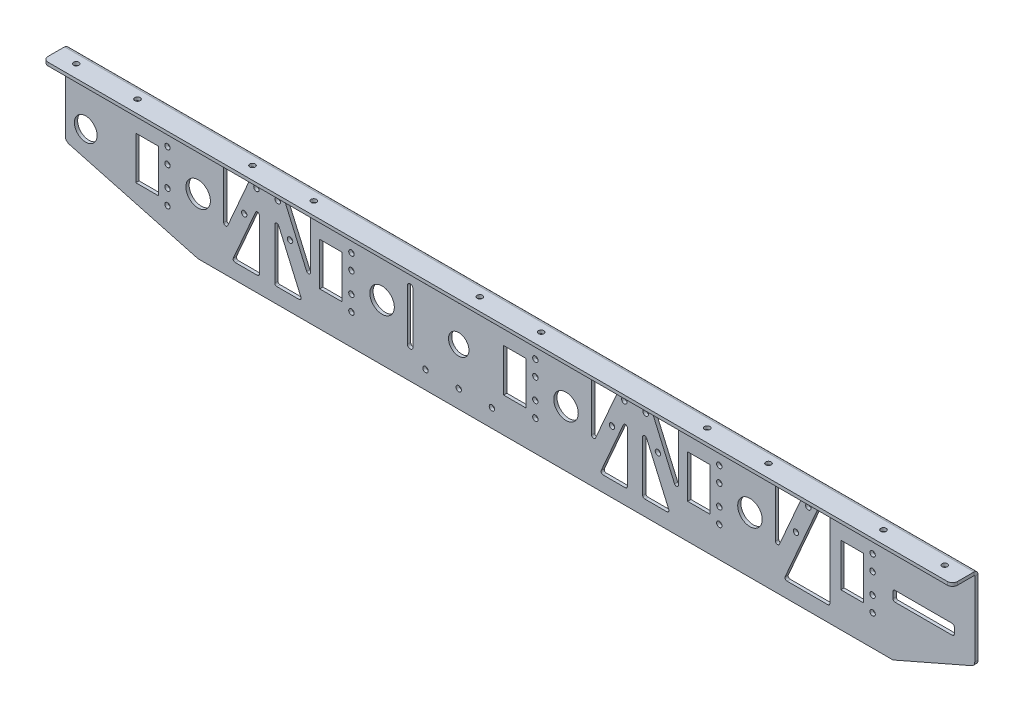
from build123d import *

# Parameters (mm, degrees)
SKETCH1_R                                  = 11.9875
SKETCH1_R_2                                = 11.1125
SKETCH1_W                                  = 60
SKETCH1_H                                  = 10.02
BASE_FLANGE1_DEPTH                         = 3.175
M5_CLEARANCE_HOLE1_D                       = 5.3
INNER_START                                = -3.175
SKETCH9_W                                  = 22
SKETCH9_H                                  = 42
SKETCH9_R                                  = 2.65
INNER_PLATE_CUT_EXTRUDE3_DEPTH             = 3.175
SKETCH8_R                                  = 2.65
SWISS_CHEESE_CUTOUT_DEPTH                  = 3.175
FILLET1_R                                  = 2
OUTWARD_EDGE_FLANGE_STRIP_W                = 14.1732
OUTWARD_EDGE_FLANGE_STRIP_H                = 3.175
OUTWARD_EDGE_FLANGE_STRIP_CUT_DEPTH        = 890
OUTWARD_EDGE_FLANGE_DEPTH                  = 890
OUTWARD_M5_CLEARANCE_HOLE4_D               = 5.3
FILLET3_R                                  = 5
SKETCH13_W                                 = 85
SKETCH13_H                                 = 80
INNER_PLATE_SWISS_CHEESE_FILL_DEPTH        = 3.175
INNER_PLATE_MOTOR_MOUNT_REACH              = 764.677
SKETCH14_R                                 = 10
INNER_PLATE_MOTOR_M5_CLEARANCE_HOLES_D     = 5.3
INNER_PLATE_MOTOR_M5_CLEARANCE_HOLES_DEPTH = 5
INNER_PLATE_MOTOR_M5_CLEARANCE_HOLES_TIP   = 1.59228064


# Sheet-metal steps are written as plain solids
with BuildPart() as part:
    # Sketch1 → Base-Flange1 (new body)
    with BuildSketch(Plane.XY):
        Polygon((-130, 60), (760, 60), (760, -20), (680, -55), (0, -55), (-130, -20), align=None)
        Circle(SKETCH1_R, mode=Mode.SUBTRACT)
        with Locations((180, 0)):
            Circle(SKETCH1_R, mode=Mode.SUBTRACT)
        with Locations((360, 0)):
            Circle(SKETCH1_R, mode=Mode.SUBTRACT)
        with Locations((540, 0)):
            Circle(SKETCH1_R, mode=Mode.SUBTRACT)
        with Locations((-110, 0)):
            Circle(SKETCH1_R_2, mode=Mode.SUBTRACT)
        with Locations((710, 0)):
            Rectangle(SKETCH1_W, SKETCH1_H, mode=Mode.SUBTRACT)
    extrude(amount=-BASE_FLANGE1_DEPTH)

    # M5 Clearance Hole1 (through all)
    with Locations(Plane(origin=(-50, 10, 0), x_dir=(1, 0, 0), z_dir=(0, 0, 1))):
        with Locations((0, 0), (0, -20), (20, -35), (20, 15), (180, 0), (180, -20), (200, -35), (200, 15), (360, 0), (360, -20), (380, -35), (380, 15), (540, 0), (540, -20), (560, -35), (560, 15), (690, 0), (690, -20), (710, 15), (710, -35), (20, 0), (20, -20), (200, 0), (200, -20), (380, 0), (380, -20), (560, 0), (560, -20), (710, 0), (710, -20)):
            Hole(M5_CLEARANCE_HOLE1_D / 2)

    # Sketch9 → Inner Plate Cut-Extrude3 (cut)
    # profile 1 of 7: a face of its own
    with BuildSketch(Plane.XY.offset(INNER_START)):
        with Locations((-50, 0)):
            Rectangle(SKETCH9_W, SKETCH9_H)
        with BuildLine():
            ThreePointArc((-47.35, -10), (-51.87383297, -11.87383297), (-50, -7.35))
            ThreePointArc((-50, -7.35), (-48.12616703, -8.12616703), (-47.35, -10))
        make_face(mode=Mode.SUBTRACT)
        with BuildLine():
            ThreePointArc((-47.35, 10), (-48.12616703, 8.12616703), (-50, 7.35))
            ThreePointArc((-50, 7.35), (-51.87383297, 11.87383297), (-47.35, 10))
        make_face(mode=Mode.SUBTRACT)
    # profile 2 of 7: a face of its own
    with BuildSketch(Plane.XY.offset(INNER_START)):
        with Locations((130, 0)):
            Rectangle(SKETCH9_W, SKETCH9_H)
        with Locations((130, -10)):
            Circle(SKETCH9_R, mode=Mode.SUBTRACT)
        with Locations((130, 10)):
            Circle(SKETCH9_R, mode=Mode.SUBTRACT)
    # profile 3 of 7: a face of its own
    with BuildSketch(Plane.XY.offset(INNER_START)):
        with Locations((310, 0)):
            Rectangle(SKETCH9_W, SKETCH9_H)
        with Locations((310, -10)):
            Circle(SKETCH9_R, mode=Mode.SUBTRACT)
        with Locations((310, 10)):
            Circle(SKETCH9_R, mode=Mode.SUBTRACT)
    # profile 4 of 7: a face of its own
    with BuildSketch(Plane.XY.offset(INNER_START)):
        with Locations((490, 0)):
            Rectangle(SKETCH9_W, SKETCH9_H)
        with Locations((490, -10)):
            Circle(SKETCH9_R, mode=Mode.SUBTRACT)
        with Locations((490, 10)):
            Circle(SKETCH9_R, mode=Mode.SUBTRACT)
    # profile 5 of 7: a face of its own
    with BuildSketch(Plane.XY.offset(INNER_START)):
        with Locations((640, 0)):
            Rectangle(SKETCH9_W, SKETCH9_H)
        with Locations((640, -10)):
            Circle(SKETCH9_R, mode=Mode.SUBTRACT)
        with Locations((640, 10)):
            Circle(SKETCH9_R, mode=Mode.SUBTRACT)
    # profile 6 of 7: a face of its own
    with BuildSketch(Plane.XY.offset(INNER_START)):
        with Locations((-30, -10)):
            Circle(SKETCH9_R)
    # profile 7 of 7: a face of its own
    with BuildSketch(Plane.XY.offset(INNER_START)):
        with Locations((-30, 10)):
            Circle(SKETCH9_R)
    extrude(amount=INNER_PLATE_CUT_EXTRUDE3_DEPTH, mode=Mode.SUBTRACT)

    # Sketch8 → Swiss Cheese Cutout (cut)
    with BuildSketch(Plane.XY):
        Polygon((51.813633189, 40), (25, 40), (25, -21.288304432), align=None)
        Polygon((60, -40), (33.186366811, -40), (60, 21.288304432), align=None)
        Polygon((75, -40), (75, 21.288304432), (101.813633189, -40), align=None)
        Polygon((110, 40), (110, -21.288304432), (83.186366811, 40), align=None)
        Polygon((231.813633189, 40), (205, -21.288304432), (205, 40), align=None)
        Polygon((240, 21.288304432), (240, -40), (213.186366811, -40), align=None)
        Polygon((281.813633189, -40), (255, -40), (255, 21.288304432), align=None)
        Polygon((263.186366811, 40), (290, 40), (290, -21.288304432), align=None)
        Polygon((411.813633189, 40), (385, -21.288304432), (385, 40), align=None)
        Polygon((420, 21.288304432), (420, -40), (393.186366811, -40), align=None)
        Polygon((461.813633189, -40), (435, -40), (435, 21.288304432), align=None)
        Polygon((443.186366811, 40), (470, 40), (470, -21.288304432), align=None)
        Polygon((591.813633189, 40), (565, -21.288304432), (565, 40), align=None)
        Polygon((600, 21.288304432), (600, -40), (573.186366811, -40), align=None)
        Polygon((618.186366811, 40), (608.186366811, 40), (600, 21.288304432), (600, -40), (618.186366811, -40), align=None)
        with Locations((225.040941701, 5.807866745)):
            Circle(SKETCH8_R)
        with Locations((237.065506722, 33.292586792)):
            Circle(SKETCH8_R)
        with Locations((405.040941701, 5.807866745)):
            Circle(SKETCH8_R)
        with Locations((417.065506722, 33.292586792)):
            Circle(SKETCH8_R)
        with Locations((585.040941701, 5.807866745)):
            Circle(SKETCH8_R)
        with Locations((597.065506722, 33.292586792)):
            Circle(SKETCH8_R)
        with Locations((77.934493278, 33.292586792)):
            Circle(SKETCH8_R)
        with Locations((89.959058299, 5.807866745)):
            Circle(SKETCH8_R)
        with Locations((257.934493278, 33.292586792)):
            Circle(SKETCH8_R)
        with Locations((269.959058299, 5.807866745)):
            Circle(SKETCH8_R)
        with Locations((437.934493278, 33.292586792)):
            Circle(SKETCH8_R)
        with Locations((449.959058299, 5.807866745)):
            Circle(SKETCH8_R)
        with Locations((45.040941701, 5.807866745)):
            Circle(SKETCH8_R)
        with Locations((57.065506722, 33.292586792)):
            Circle(SKETCH8_R)
    extrude(amount=-SWISS_CHEESE_CUTOUT_DEPTH, mode=Mode.SUBTRACT)

    # Fillet1
    fillet1_edges = [part.edges().sort_by_distance(p)[0] for p in [
        (680, -5.01, -1.5875),
        (680, 5.01, -1.5875),
        (740, 5.01, -1.5875),
        (740, -5.01, -1.5875),
        (591.813633189, 40, -1.5875),
        (565, -21.288304432, -1.5875),
        (565, 40, -1.5875),
        (443.186366811, 40, -1.5875),
        (470, 40, -1.5875),
        (470, -21.288304432, -1.5875),
        (461.813633189, -40, -1.5875),
        (435, -40, -1.5875),
        (435, 21.288304432, -1.5875),
        (420, 21.288304432, -1.5875),
        (420, -40, -1.5875),
        (393.186366811, -40, -1.5875),
        (618.186366811, -40, -1.5875),
        (573.186366811, -40, -1.5875),
        (608.186366811, 40, -1.5875),
        (618.186366811, 40, -1.5875),
        (231.813633189, 40, -1.5875),
        (205, -21.288304432, -1.5875),
        (205, 40, -1.5875),
        (110, 40, -1.5875),
        (110, -21.288304432, -1.5875),
        (83.186366811, 40, -1.5875),
        (75, -40, -1.5875),
        (75, 21.288304432, -1.5875),
        (101.813633189, -40, -1.5875),
        (60, -40, -1.5875),
        (33.186366811, -40, -1.5875),
        (60, 21.288304432, -1.5875),
        (411.813633189, 40, -1.5875),
        (385, -21.288304432, -1.5875),
        (385, 40, -1.5875),
        (263.186366811, 40, -1.5875),
        (290, 40, -1.5875),
        (290, -21.288304432, -1.5875),
        (281.813633189, -40, -1.5875),
        (255, -40, -1.5875),
        (255, 21.288304432, -1.5875),
        (240, 21.288304432, -1.5875),
        (240, -40, -1.5875),
        (213.186366811, -40, -1.5875),
        (25, 40, -1.5875),
        (51.813633189, 40, -1.5875),
        (25, -21.288304432, -1.5875),
    ]]
    fillet(fillet1_edges, radius=FILLET1_R)

    # Outward Edge-Flange strip (across the edge) → Outward Edge-Flange strip cut (cut)
    with BuildSketch(Plane(origin=(760, 60, 0), x_dir=(0, -1, 0), z_dir=(-1, 0, 0))):
        with Locations((-3.175, -1.5875)):
            Rectangle(OUTWARD_EDGE_FLANGE_STRIP_W, OUTWARD_EDGE_FLANGE_STRIP_H)
    extrude(amount=OUTWARD_EDGE_FLANGE_STRIP_CUT_DEPTH, mode=Mode.SUBTRACT)

    # Outward Edge-Flange section (across the edge) → Outward Edge-Flange (add)
    with BuildSketch(Plane(origin=(760, 60, 0), x_dir=(0, -1, 0), z_dir=(-1, 0, 0))):
        with BuildLine():
            Line((0, 0.7366), (0, 21.825))
            Line((0, 21.825), (3.175, 21.825))
            Line((3.175, 21.825), (3.175, 0.7366))
            ThreePointArc((3.175, 0.7366), (3.390745145, 0.215745145), (3.9116, 0))
            Line((3.9116, 0), (3.9116, -3.175))
            ThreePointArc((3.9116, -3.175), (1.145681115, -2.029318885), (0, 0.7366))
        make_face()
    extrude(amount=OUTWARD_EDGE_FLANGE_DEPTH)

    # Outward M5 Clearance Hole4 (through all)
    with Locations(Plane(origin=(-110, 60, 9.325), x_dir=(0, 0, 1), z_dir=(0, 1, 0))):
        with Locations((0, 0), (0, 60), (0, 172.5), (0, 232.5), (0, 395), (0, 455), (0, 617.5), (0, 677.5), (0, 790), (0, 850)):
            Hole(OUTWARD_M5_CLEARANCE_HOLE4_D / 2)

    # Fillet3
    fillet3_edges = [part.edges().sort_by_distance(p)[0] for p in [
        (760, -20, -1.5875),
        (680, -55, -1.5875),
        (0, -55, -1.5875),
        (-130, -20, -1.5875),
        (760, 58.4125, 21.825),
        (-130, 58.4125, 21.825),
    ]]
    fillet(fillet3_edges, radius=FILLET3_R)

    # Sketch13 → Inner Plate Swiss Cheese Fill (add)
    with BuildSketch(Plane.XY):
        with Locations((247.5, 0)):
            Rectangle(SKETCH13_W, SKETCH13_H)
    extrude(amount=-INNER_PLATE_SWISS_CHEESE_FILL_DEPTH)

    # Sketch14 → Inner Plate Motor Mount (cut, up to next)
    with BuildSketch(Plane.XY, mode=Mode.PRIVATE) as inner_plate_motor_mount_sk1:
        with Locations((255, 0)):
            Circle(SKETCH14_R)
    inner_plate_motor_mount_tool1 = extrude(inner_plate_motor_mount_sk1.sketch, amount=-INNER_PLATE_MOTOR_MOUNT_REACH, mode=Mode.PRIVATE) & part.part
    # Sketch14 → Inner Plate Motor Mount (cut, up to next)
    with BuildSketch(Plane.XY, mode=Mode.PRIVATE) as inner_plate_motor_mount_sk2:
        with BuildLine():
            Line((204.85, 25), (204.85, -25))
            ThreePointArc((204.85, -25), (207.5, -27.65), (210.15, -25))
            Line((210.15, -25), (210.15, 25))
            ThreePointArc((210.15, 25), (207.5, 27.65), (204.85, 25))
        make_face()
    inner_plate_motor_mount_tool2 = extrude(inner_plate_motor_mount_sk2.sketch, amount=-INNER_PLATE_MOTOR_MOUNT_REACH, mode=Mode.PRIVATE) & part.part
    add(inner_plate_motor_mount_tool1.solids().sort_by_distance((255, 0, 0))[0], mode=Mode.SUBTRACT)
    add(inner_plate_motor_mount_tool2.solids().sort_by_distance((207.5, 0, 0))[0], mode=Mode.SUBTRACT)

    # Inner Plate Motor M5 Clearance Holes
    with Locations(Plane(origin=(222.5, 37.5, 0), x_dir=(1, 0, 0), z_dir=(0, 0, 1))):
        with Locations((0, 0), (65, 0), (65, -75), (0, -75), (32.5, 0), (32.5, -75)):
            Hole(INNER_PLATE_MOTOR_M5_CLEARANCE_HOLES_D / 2, depth=INNER_PLATE_MOTOR_M5_CLEARANCE_HOLES_DEPTH)
            with Locations((0, 0, -(INNER_PLATE_MOTOR_M5_CLEARANCE_HOLES_DEPTH + INNER_PLATE_MOTOR_M5_CLEARANCE_HOLES_TIP / 2))):  # 118° drill point
                Cone(0, INNER_PLATE_MOTOR_M5_CLEARANCE_HOLES_D / 2, INNER_PLATE_MOTOR_M5_CLEARANCE_HOLES_TIP, mode=Mode.SUBTRACT)


solid = part.part
